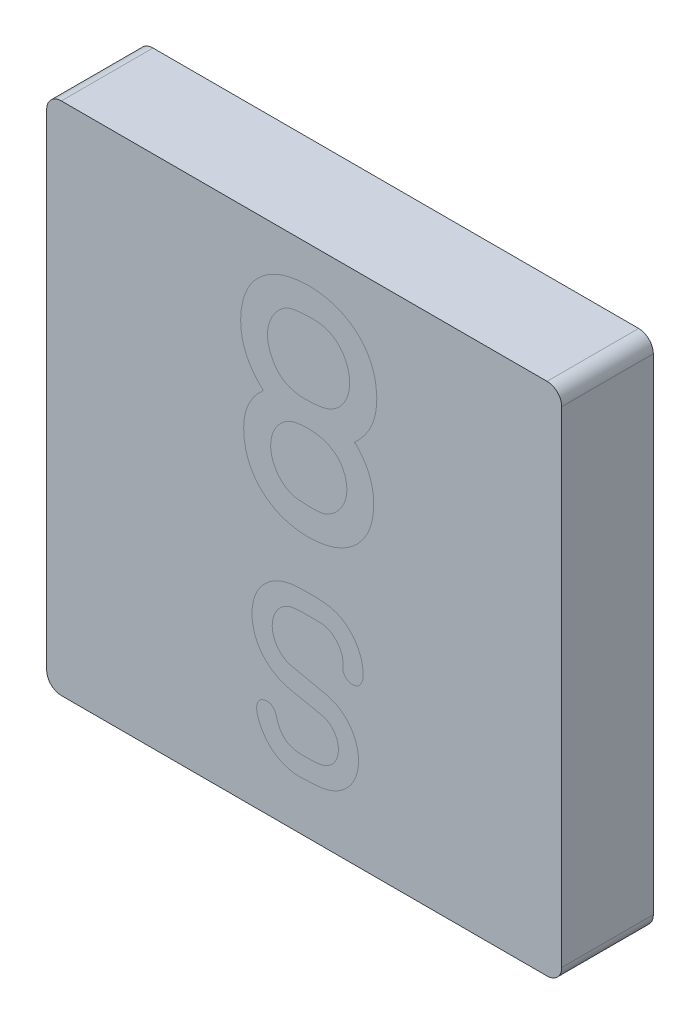
from build123d import *

# Parameters (mm, degrees)
BOSS_EXTRUDE1_DEPTH = 1.5875


with BuildPart() as part:
    # Sketch1 → Boss-Extrude1 (new body)
    with BuildSketch(Plane.XY):
        with BuildLine():
            Line((4.207, 4.461), (-4.207, 4.461))
            ThreePointArc((-4.207, 4.461), (-4.386605122, 4.386605122), (-4.461, 4.207))
            Line((-4.461, 4.207), (-4.461, -4.207))
            ThreePointArc((-4.461, -4.207), (-4.386605122, -4.386605122), (-4.207, -4.461))
            Line((-4.207, -4.461), (4.207, -4.461))
            ThreePointArc((4.207, -4.461), (4.386605122, -4.386605122), (4.461, -4.207))
            Line((4.461, -4.207), (4.461, 4.207))
            ThreePointArc((4.461, 4.207), (4.386605122, 4.386605122), (4.207, 4.461))
        make_face()
    extrude(amount=BOSS_EXTRUDE1_DEPTH)


solid = part.part
